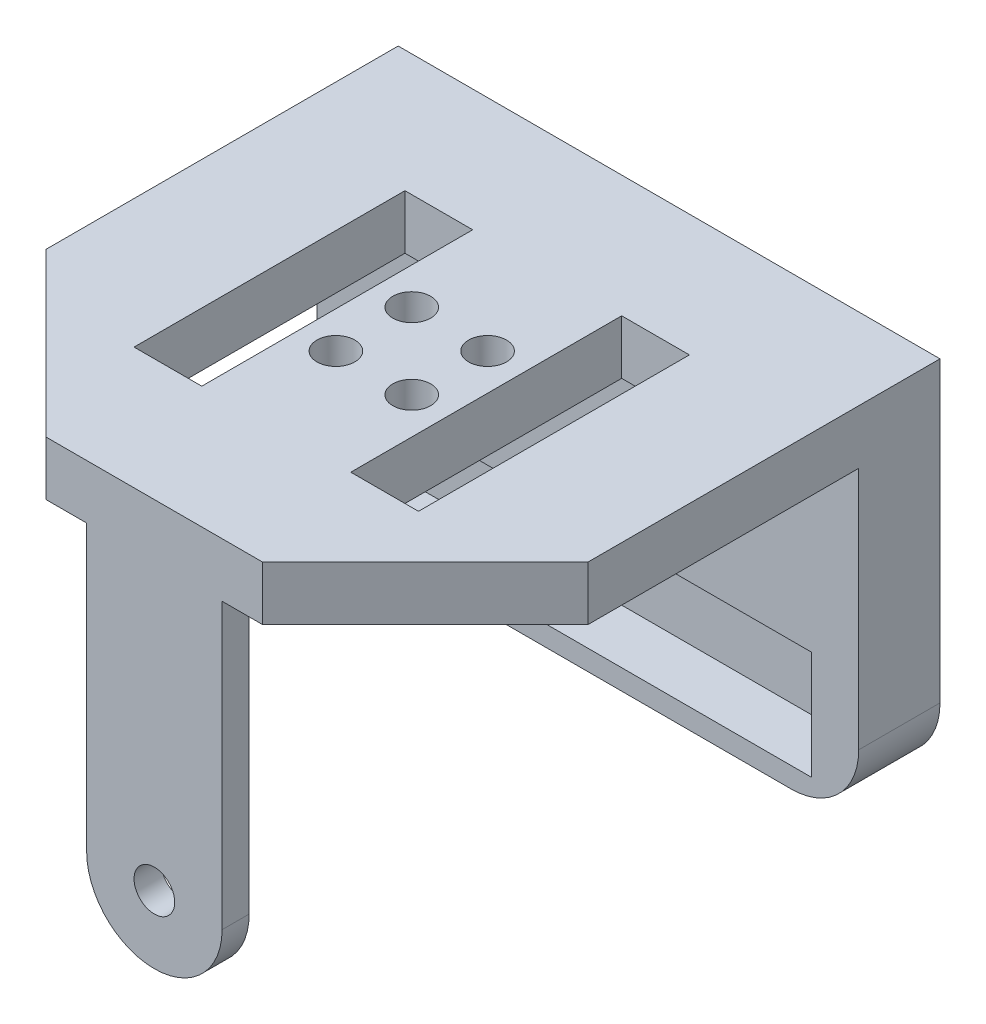
from build123d import *

# Parameters (mm, degrees)
SCHIZZO3_W                   = 40
SCHIZZO3_H                   = 27
ESTRUSIONE_ESTRUSIONE1_DEPTH = 6
SCHIZZO4_W                   = 33
SCHIZZO4_H                   = 8
TAGLIO_ESTRUSIONE1_DEPTH     = 4
SCHIZZO5_R                   = 1.05
TAGLIO_ESTRUSIONE2_DEPTH     = 25.459149617
SCHIZZO6_W                   = 40
SCHIZZO6_H                   = 4
ESTRUSIONE_ESTRUSIONE2_DEPTH = 32
SCHIZZO7_W                   = 10
SCHIZZO7_H                   = 2
ESTRUSIONE_ESTRUSIONE3_DEPTH = 26
SCHIZZO8_R                   = 1.4
SCHIZZO8_W                   = 5
SCHIZZO8_H                   = 20
TAGLIO_ESTRUSIONE3_DEPTH     = 53.383203415
RACCORDO1_R                  = 5
TAGLIO_ESTRUSIONE4_REACH     = 46.365
SCHIZZO9_R                   = 1.5


with BuildPart() as part:
    # Schizzo3 → Estrusione-Estrusione1 (new body)
    with BuildSketch(Plane.XY):
        Rectangle(SCHIZZO3_W, SCHIZZO3_H)
    extrude(amount=ESTRUSIONE_ESTRUSIONE1_DEPTH)

    # Schizzo4 → Taglio-Estrusione1 (cut)
    with BuildSketch(Plane.XY.offset(6)):
        with Locations((0, -8)):
            Rectangle(SCHIZZO4_W, SCHIZZO4_H)
    extrude(amount=-TAGLIO_ESTRUSIONE1_DEPTH, mode=Mode.SUBTRACT)

    # Schizzo5 → Taglio-Estrusione2 (cut, through all)
    with BuildSketch(Plane.XY.offset(2)):
        with Locations((0, -8)):
            Circle(SCHIZZO5_R)
    extrude(amount=-TAGLIO_ESTRUSIONE2_DEPTH, mode=Mode.SUBTRACT)

    # Schizzo6 → Estrusione-Estrusione2 (add)
    with BuildSketch(Plane.XY.offset(6)):
        with Locations((0, 11.5)):
            Rectangle(SCHIZZO6_W, SCHIZZO6_H)
    extrude(amount=ESTRUSIONE_ESTRUSIONE2_DEPTH)

    # Schizzo7 → Estrusione-Estrusione3 (add)
    with BuildSketch(Plane.XZ.offset(-9.5)):
        with Locations((0, 37)):
            Rectangle(SCHIZZO7_W, SCHIZZO7_H)
    extrude(amount=ESTRUSIONE_ESTRUSIONE3_DEPTH)

    # Schizzo8 → Taglio-Estrusione3 (cut, through all)
    with BuildSketch(Plane(origin=(0, 13.5, 0), x_dir=(1, 0, 0), z_dir=(0, 1, 0))):
        with Locations(Location((-2.8, -16.2, 0), (0, 0, 270))):
            Circle(SCHIZZO8_R)
        with Locations(Location((-2.8, -21.8, 0), (0, 0, 270))):
            Circle(SCHIZZO8_R)
        with Locations(Location((2.8, -21.8, 0), (0, 0, 270))):
            Circle(SCHIZZO8_R)
        with Locations(Location((2.8, -16.2, 0), (0, 0, 270))):
            Circle(SCHIZZO8_R)
        with Locations((8, -19)):
            Rectangle(SCHIZZO8_W, SCHIZZO8_H)
        with Locations((-8, -19)):
            Rectangle(SCHIZZO8_W, SCHIZZO8_H)
        Polygon((-20, -26), (-8, -38), (-20, -38), align=None)
        Polygon((8, -38), (20, -38), (20, -26), align=None)
    extrude(amount=-TAGLIO_ESTRUSIONE3_DEPTH, mode=Mode.SUBTRACT)

    # Raccordo1
    raccordo1_edges = [part.edges().sort_by_distance(p)[0] for p in [
        (-5, -16.5, 37),
        (5, -16.5, 37),
        (20, -13.5, 3),
        (-20, -13.5, 3),
    ]]
    fillet(raccordo1_edges, radius=RACCORDO1_R - 0.0001)  # a hair under: the kernel refuses the full size

    # Schizzo9 → Taglio-Estrusione4 (cut, up to next)
    with BuildSketch(Plane(origin=(0, 0, 36), x_dir=(-1, 0, 0), z_dir=(0, 0, -1)), mode=Mode.PRIVATE) as taglio_estrusione4_sk1:
        with Locations((0, -11.5)):
            Circle(SCHIZZO9_R)
    taglio_estrusione4_tool1 = extrude(taglio_estrusione4_sk1.sketch, amount=-TAGLIO_ESTRUSIONE4_REACH, mode=Mode.PRIVATE) & part.part
    add(taglio_estrusione4_tool1.solids().sort_by_distance((0, -11.5, 36))[0], mode=Mode.SUBTRACT)


solid = part.part
